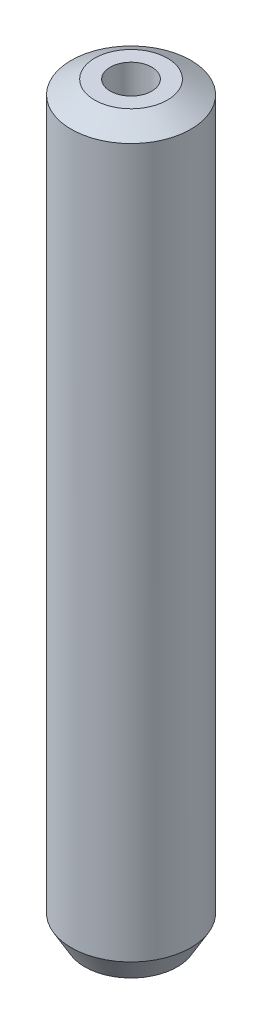
from build123d import *
from OCP.BRepFilletAPI import BRepFilletAPI_MakeChamfer

# Parameters (mm, degrees)
SKETCH1_R           = 7.5
BOSS_EXTRUDE1_DEPTH = 93.553479587
SKETCH2_R           = 2.606525452
CUT_EXTRUDE1_DEPTH  = 95.152820153
CHAMFER1_SIZE       = 1.698107232
CHAMFER1_SIZE2      = 2.941208002


with BuildPart() as part:
    # Sketch1 → Boss-Extrude1 (new body)
    with BuildSketch(Plane(origin=(0, 0, 0), x_dir=(1, 0, 0), z_dir=(0, 1, 0))):
        Circle(SKETCH1_R)
    extrude(amount=BOSS_EXTRUDE1_DEPTH)

    # Sketch2 → Cut-Extrude1 (cut, through all)
    with BuildSketch(Plane(origin=(0, 0, 0), x_dir=(1, 0, 0), z_dir=(0, 1, 0))):
        Circle(SKETCH2_R)
    extrude(amount=CUT_EXTRUDE1_DEPTH, mode=Mode.SUBTRACT)

    # Chamfer1: one chamfer whose edges measure the first distance from different faces: ONE call of the kernel's chamfer builder (chamfer() names one face for all edges)
    chamfer1_edges_1 = [part.edges().sort_by_distance(p)[0] for p in [
        (-7.5, 93.553479587, 0),
    ]]
    chamfer1_side_1 = [part.faces().sort_by_distance(p)[0] for p in [
        (-7.5, 46.776739794, 0),
    ]]
    chamfer1_edges_2 = [part.edges().sort_by_distance(p)[0] for p in [
        (-7.5, 0, 0),
    ]]
    chamfer1_side_2 = [part.faces().sort_by_distance(p)[0] for p in [
        (-7.287867966, 0, 0),
    ]]
    chamfer1 = BRepFilletAPI_MakeChamfer(part.part.solid().wrapped)
    for e in chamfer1_edges_1:
        chamfer1.Add(CHAMFER1_SIZE, CHAMFER1_SIZE2, e.wrapped, chamfer1_side_1[0].wrapped)  # the first distance lies on this face
    for e in chamfer1_edges_2:
        chamfer1.Add(CHAMFER1_SIZE, CHAMFER1_SIZE2, e.wrapped, chamfer1_side_2[0].wrapped)  # the first distance lies on this face
    add(Compound.cast(chamfer1.Shape()), mode=Mode.REPLACE)


solid = part.part
